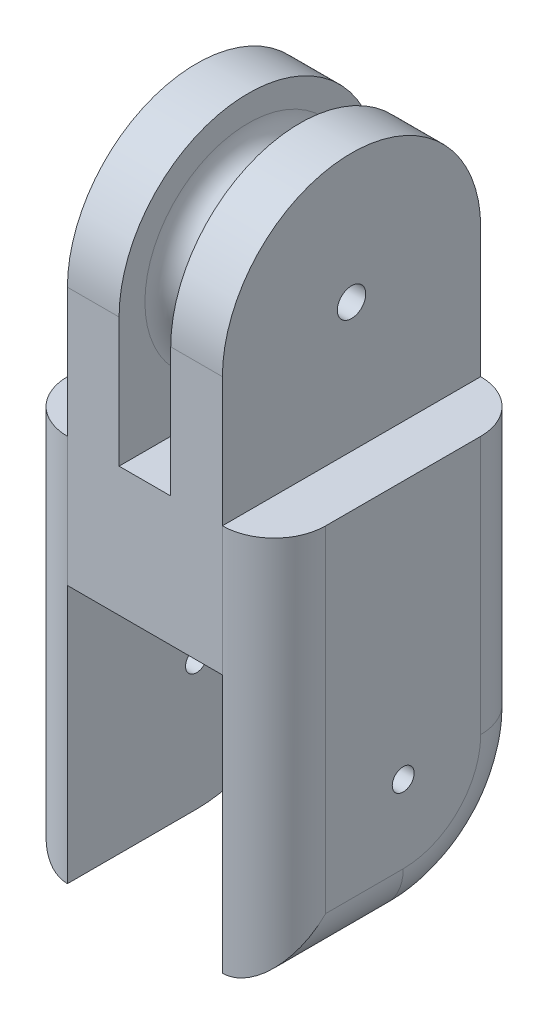
from build123d import *

# Parameters (mm, degrees)
SKETCH1_W           = 20
SKETCH1_H           = 20
BOSS_EXTRUDE1_DEPTH = 10
SKETCH4_W           = 4
SKETCH4_H           = 20
BOSS_EXTRUDE2_DEPTH = 10
BOSS_EXTRUDE3_DEPTH = 4
BOSS_EXTRUDE4_START = -4
BOSS_EXTRUDE4_DEPTH = 4
SKETCH7_R           = 0.85
CUT_EXTRUDE1_DEPTH  = 31
FILLET1_R           = 4
SKETCH8_W           = 4
SKETCH8_H           = 20
BOSS_EXTRUDE5_DEPTH = 10
SKETCH9_R           = 10
BOSS_EXTRUDE6_DEPTH = 4
BOSS_EXTRUDE7_START = -4
SKETCH10_R          = 10
BOSS_EXTRUDE7_DEPTH = 4
SKETCH12_R          = 1.1
CUT_EXTRUDE2_DEPTH  = 36.440090293
SKETCH13_R          = 6
BOSS_EXTRUDE8_DEPTH = 4
SKETCH14_R          = 1.1
CUT_EXTRUDE3_DEPTH  = 4
FILLET2_R           = 2
CUT_EXTRUDE4_REACH  = 35.166
SKETCH16_R          = 0.5


with BuildPart() as part:
    # Sketch1 → Boss-Extrude1 (new body)
    with BuildSketch(Plane(origin=(0, 0, 0), x_dir=(1, 0, 0), z_dir=(0, 1, 0))):
        Rectangle(SKETCH1_W, SKETCH1_H)
    extrude(amount=BOSS_EXTRUDE1_DEPTH)

    # Sketch4 → Boss-Extrude2 (add)
    with BuildSketch(Plane.XZ):
        with Locations((-8, 0)):
            Rectangle(SKETCH4_W, SKETCH4_H)
        with Locations((8, 0)):
            Rectangle(SKETCH4_W, SKETCH4_H)
    extrude(amount=BOSS_EXTRUDE2_DEPTH)

    # Sketch5 → Boss-Extrude3 (add)
    with BuildSketch(Plane.ZY.offset(10)):
        with BuildLine():
            Line((0, -20), (10, -20))
            Line((10, -20), (10, -10))
            ThreePointArc((10, -10), (-7.071067812, -2.928932188), (0, -20))
        make_face()
    extrude(amount=-BOSS_EXTRUDE3_DEPTH)

    # Sketch6 → Boss-Extrude4 (add)
    with BuildSketch(Plane(origin=(10, 0, 0), x_dir=(0, 0, -1), z_dir=(1, 0, 0)).offset(BOSS_EXTRUDE4_START)):
        with BuildLine():
            Line((0, -20), (-10, -20))
            Line((-10, -20), (-10, -10))
            ThreePointArc((-10, -10), (7.071067812, -2.928932188), (0, -20))
        make_face()
    extrude(amount=BOSS_EXTRUDE4_DEPTH)

    # Sketch7 → Cut-Extrude1 (cut, through all)
    with BuildSketch(Plane.ZY.offset(10)):
        with Locations((0, -10)):
            Circle(SKETCH7_R)
    extrude(amount=-CUT_EXTRUDE1_DEPTH, mode=Mode.SUBTRACT)

    # Fillet1
    fillet1_edges = [part.edges().sort_by_distance(p)[0] for p in [
        (-10, -5, 10),
        (-10, -17.071067812, -7.071067812),
        (10, -5, 10),
        (10, -17.071067812, -7.071067812),
        (-10, 0, -10),
        (10, 0, -10),
        (10, -20, 5),
        (-10, -20, 5),
    ]]
    fillet(fillet1_edges, radius=FILLET1_R - 0.0001)  # a hair under: the kernel refuses the full size

    # Sketch8 → Boss-Extrude5 (add)
    with BuildSketch(Plane(origin=(0, 10, 0), x_dir=(1, 0, 0), z_dir=(0, 1, 0))):
        with Locations((4, 0)):
            Rectangle(SKETCH8_W, SKETCH8_H)
        with Locations((-4, 0)):
            Rectangle(SKETCH8_W, SKETCH8_H)
    extrude(amount=BOSS_EXTRUDE5_DEPTH)

    # Sketch9 → Boss-Extrude6 (add)
    with BuildSketch(Plane(origin=(6, 0, 0), x_dir=(0, 0, -1), z_dir=(1, 0, 0))):
        with Locations((0, 20)):
            Circle(SKETCH9_R)
    extrude(amount=-BOSS_EXTRUDE6_DEPTH)

    # Sketch10 → Boss-Extrude7 (add)
    with BuildSketch(Plane.ZY.offset(6).offset(BOSS_EXTRUDE7_START)):
        with Locations((0, 20)):
            Circle(SKETCH10_R)
    extrude(amount=BOSS_EXTRUDE7_DEPTH)

    # Sketch12 → Cut-Extrude2 (cut, through all)
    with BuildSketch(Plane.ZY.offset(6)):
        with Locations((0, 20)):
            Circle(SKETCH12_R)
    extrude(amount=-CUT_EXTRUDE2_DEPTH, mode=Mode.SUBTRACT)

    # Sketch13 → Boss-Extrude8 (add)
    with BuildSketch(Plane(origin=(-2, 0, 0), x_dir=(0, 0, -1), z_dir=(1, 0, 0))):
        with Locations(Location((0, 20, 0), (0, 0, 180))):
            Circle(SKETCH13_R)
    extrude(amount=BOSS_EXTRUDE8_DEPTH)

    # Sketch14 → Cut-Extrude3 (cut)
    with BuildSketch(Plane(origin=(-2, 0, 0), x_dir=(0, 0, -1), z_dir=(1, 0, 0))):
        with Locations(Location((0, 20, 0), (0, 0, 180))):
            Circle(SKETCH14_R)
    extrude(amount=CUT_EXTRUDE3_DEPTH, mode=Mode.SUBTRACT)

    # Fillet2
    fillet2_edges = [part.edges().sort_by_distance(p)[0] for p in [
        (-2, 20, -6),
        (2, 20, -6),
    ]]
    fillet(fillet2_edges, radius=FILLET2_R - 0.0001)  # a hair under: the kernel refuses the full size

    # Sketch16 → Cut-Extrude4 (cut, up to next)
    with BuildSketch(Plane.XZ, mode=Mode.PRIVATE) as cut_extrude4_sk1:
        with Locations(Location((0, -6, 0), (0, 0, 270))):
            Circle(SKETCH16_R)
    cut_extrude4_tool1 = extrude(cut_extrude4_sk1.sketch, amount=-CUT_EXTRUDE4_REACH, mode=Mode.PRIVATE) & part.part
    # Sketch16 → Cut-Extrude4 (cut, up to next)
    with BuildSketch(Plane.XZ, mode=Mode.PRIVATE) as cut_extrude4_sk2:
        with Locations(Location((0, 6, 0), (0, 0, 90))):
            Circle(SKETCH16_R)
    cut_extrude4_tool2 = extrude(cut_extrude4_sk2.sketch, amount=-CUT_EXTRUDE4_REACH, mode=Mode.PRIVATE) & part.part
    add(cut_extrude4_tool1.solids().sort_by_distance((0, 0, -6))[0], mode=Mode.SUBTRACT)
    add(cut_extrude4_tool2.solids().sort_by_distance((0, 0, 6))[0], mode=Mode.SUBTRACT)


solid = part.part
